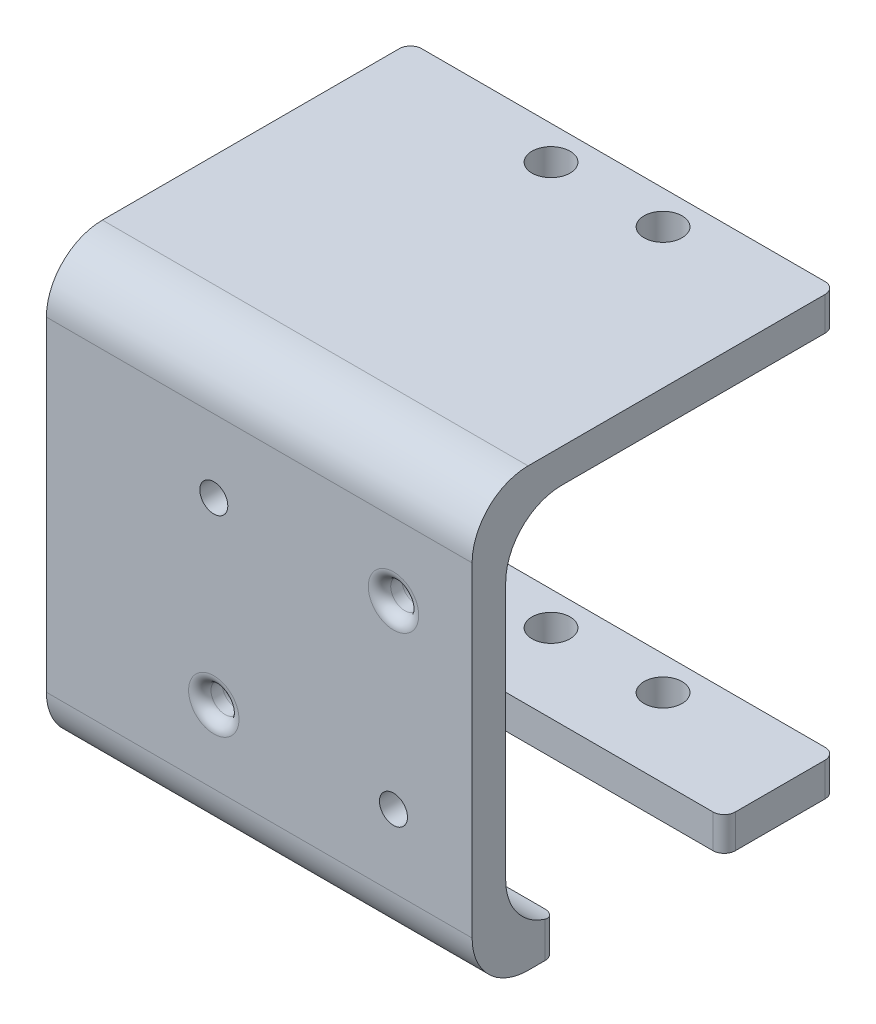
from build123d import *

# Parameters (mm, degrees)
EXTRUDE_1_DEPTH     = 30
HOLE_WIZARD_M4_1_D  = 2.5
SKETCH_13_W         = 3
SKETCH_13_H         = 21
SKETCH_13_W_2       = 29.5
SKETCH_13_H_2       = 6
EXTRUDE_2_DEPTH     = 5
HOLE_WIZARD_M3_1_D  = 3.4
HOLE_WIZARD_M3_2_D  = 3.4
SKETCH_18_W         = 33
SKETCH_18_H         = 15
CUT_EXTRUDE_1_DEPTH = 11
SKETCH_20_W         = 32.5
SKETCH_20_H         = 39
EXTRUDE_3_DEPTH     = 3
FILLET_3_R          = 5
FILLET_4_R          = 5
FILLET_5_R          = 1
HOLE_WIZARD_M3_3_D  = 3.4
SKETCH_25_W         = 6
SKETCH_25_H         = 21
CUT_EXTRUDE_3_DEPTH = 10
FILLET_6_R          = 1
FILLET1_R           = 1


with BuildPart() as part:
    # 草图1 → 凸台-拉伸1 (new body)
    with BuildSketch(Plane(origin=(0, 0, 0), x_dir=(0, 0, -1), z_dir=(1, 0, 0))):
        Polygon((0, 0), (29.5, 0), (29.5, 33), (0, 33), (0, 36), (32.5, 36), (32.5, -3), (0, -3), align=None)
    extrude(amount=EXTRUDE_1_DEPTH)

    # M4 间隙孔1 (through all)
    with Locations(Plane.XY.offset(-29.5)):
        with Locations((6.943673968, 24.5), (22.983673968, 24.55), (6.943673968, 8.5), (22.983673968, 8.45)):
            Hole(HOLE_WIZARD_M4_1_D / 2)

    # 草图13 → 凸台-拉伸2 (add)
    with BuildSketch(Plane(origin=(0, 0, 0), x_dir=(0, 0, -1), z_dir=(1, 0, 0))):
        with Locations((31, 16.5)):
            Rectangle(SKETCH_13_W, SKETCH_13_H)
        with Locations((14.75, 3)):
            Rectangle(SKETCH_13_W_2, SKETCH_13_H_2)
        Polygon((0, 0), (0, -3), (32.5, -3), (32.5, 6), (29.5, 6), (29.5, 0), align=None)
        with Locations((14.75, 30)):
            Rectangle(SKETCH_13_W_2, SKETCH_13_H_2)
        Polygon((29.5, 27), (32.5, 27), (32.5, 36), (0, 36), (0, 33), (29.5, 33), align=None)
    extrude(amount=-EXTRUDE_2_DEPTH)

    # M3 间隙孔1 (through all)
    with Locations(Plane(origin=(0, -3, 0), x_dir=(-1, 0, 0), z_dir=(0, -1, 0))):
        with Locations((-7.543673968, 3), (-17.543673968, 3)):
            Hole(HOLE_WIZARD_M3_1_D / 2)

    # M3 间隙孔2 (through all)
    with Locations(Plane.ZY.offset(5)):
        with Locations((-3, 30), (-3, 3)):
            Hole(HOLE_WIZARD_M3_2_D / 2)

    # 草图18 → 切除-拉伸1 (cut)
    with BuildSketch(Plane.XZ.offset(3)):
        with Locations((15.043673968, -17.5)):
            Rectangle(SKETCH_18_W, SKETCH_18_H)
    extrude(amount=-CUT_EXTRUDE_1_DEPTH, mode=Mode.SUBTRACT)

    # 草图20 → 凸台-拉伸3 (add)
    with BuildSketch(Plane.ZY.offset(5)):
        with Locations((-16.25, 16.5)):
            Rectangle(SKETCH_20_W, SKETCH_20_H)
    extrude(amount=EXTRUDE_3_DEPTH)

    # 圆角3
    fillet_3_edges = [part.edges().sort_by_distance(p)[0] for p in [
        (11, -3, -32.5),
        (11, 36, -32.5),
    ]]
    fillet(fillet_3_edges, radius=FILLET_3_R)

    # 圆角4
    # the kernel refuses this fillet: 5 mm, written as the material it adds along each edge
    with BuildSketch(Plane(origin=(0, 33, -29.5), x_dir=(0, -1, 0), z_dir=(1, 0, 0))) as fillet_4_piece_1:
        with BuildLine():
            CenterArc((FILLET_4_R, -FILLET_4_R), FILLET_4_R, 90, 90)
            Line((0, -FILLET_4_R), (0, 0))
            Line((0, 0), (FILLET_4_R, 0))
        make_face()
    extrude(amount=30)
    with BuildSketch(Plane(origin=(0, 0, -29.5), x_dir=(0, 0, 1), z_dir=(1, 0, 0))) as fillet_4_piece_2:
        with BuildLine():
            CenterArc((5, -4.974937186), FILLET_4_R, 95.739170477, 84.260829523)
            Line((0, -4.974937186), (0, 0))
            Line((0, 0), (4.5, 0))
        make_face()
    extrude(amount=30)

    # 圆角5
    fillet_5_edges = [part.edges().sort_by_distance(p)[0] for p in [
        (-1.456326032, 6, -17.5),
        (-0.728163016, 6, -25),
        (-0.728163016, 6, -10),
        (-1.456326032, 1.5, -25),
        (-1.456326032, 1.5, -10),
        (30, -1.5, -10),
        (30, -1.5, -25),
        (30, 34.5, 0),
        (-8, 16.5, 0),
        (30, -1.5, 0),
    ]]
    fillet(fillet_5_edges, radius=FILLET_5_R)

    # M3 间隙孔3 (through all)
    with Locations(Plane(origin=(-5, 0, 0), x_dir=(0, 0, -1), z_dir=(1, 0, 0))):
        with Locations((3, 30), (3, 3)):
            Hole(HOLE_WIZARD_M3_3_D / 2)

    # 草图25 → 切除-拉伸3 (cut)
    with BuildSketch(Plane(origin=(-5, 0, 0), x_dir=(0, 0, -1), z_dir=(1, 0, 0))):
        with Locations((3, 16.5)):
            Rectangle(SKETCH_25_W, SKETCH_25_H)
    extrude(amount=-CUT_EXTRUDE_3_DEPTH, mode=Mode.SUBTRACT)

    # 圆角6
    fillet_6_edges = [part.edges().sort_by_distance(p)[0] for p in [
        (-7.707106781, 6, -0.292893219),
        (-7.707106781, 27, -0.292893219),
        (-5, 6, -17.75),
        (-8, 16.5, -6),
        (-8, 27, -3.5),
        (-8, 6, -3.5),
        (-6.5, 27, -6),
        (-6.5, 6, -6),
        (-5, 16.5, -6),
        (-3.5, 6, 0),
        (-3.5, 27, 0),
        (-5, 27, -17.75),
    ]]
    fillet(fillet_6_edges, radius=FILLET_6_R)


with BuildPart() as body_2:
    # 镜向2: mirrored copy
    add(part.part.mirror(Plane(origin=(30, 0, 0), x_dir=(1, 0, 0), z_dir=(0, 0, -1))))

    # Fillet1
    fillet1_edges = [body_2.edges().sort_by_distance(p)[0] for p in [
        (8.193673968, 8.5, 29.5),
        (8.193673968, 8.5, 32.5),
        (24.233673968, 24.55, 29.5),
        (24.233673968, 24.55, 32.5),
    ]]
    fillet(fillet1_edges, radius=FILLET1_R)


solid = body_2.part
